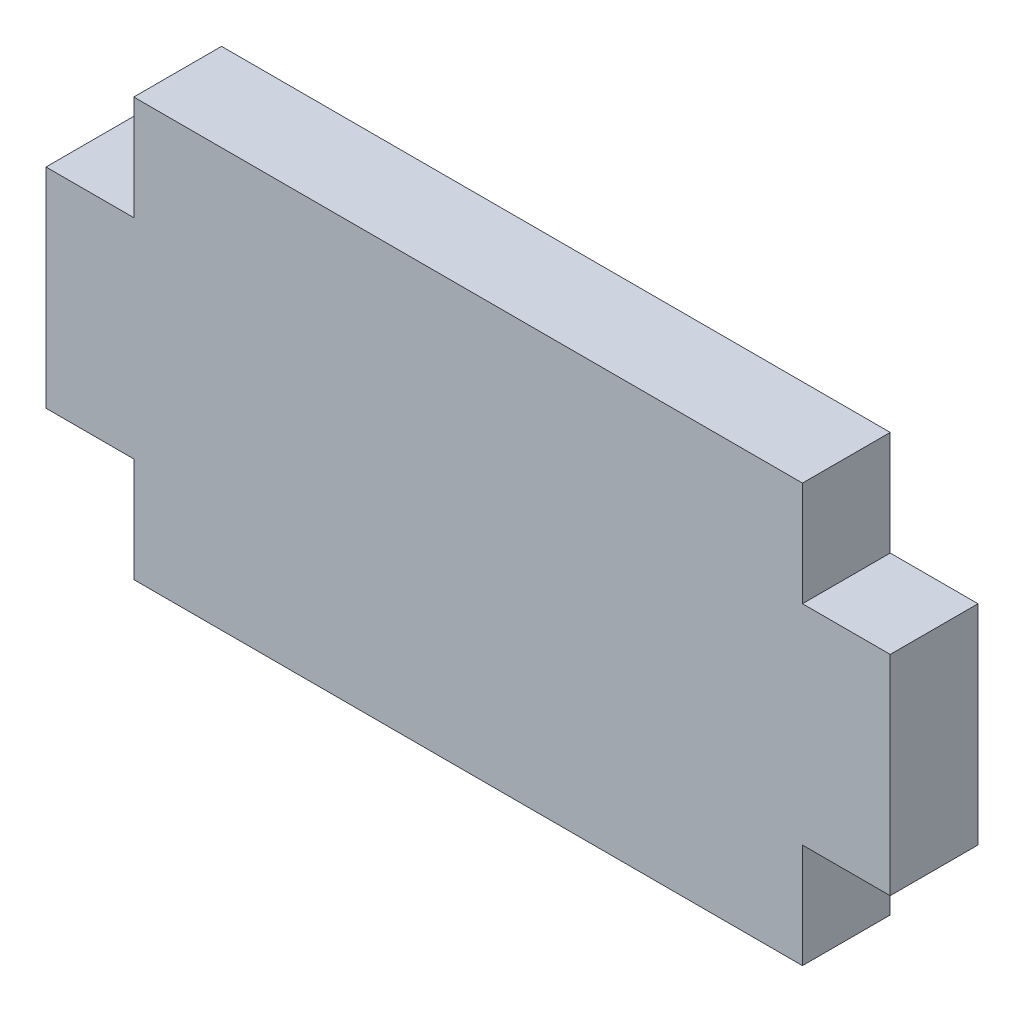
from build123d import *

# Parameters (mm, degrees)
SKETCH1_W           = 51.308
SKETCH1_H           = 25.4
BOSS_EXTRUDE1_DEPTH = 5.334
SKETCH2_W           = 5.334
SKETCH2_H           = 6.35
CUT_EXTRUDE1_DEPTH  = 114.755958488


with BuildPart() as part:
    # Sketch1 → Boss-Extrude1 (new body)
    with BuildSketch(Plane.XY):
        with Locations((-86.424766511, -6.016747393)):
            Rectangle(SKETCH1_W, SKETCH1_H)
    extrude(amount=BOSS_EXTRUDE1_DEPTH)

    # Sketch2 → Cut-Extrude1 (cut, through all)
    with BuildSketch(Plane.XY.offset(5.334)):
        with Locations((-63.437766511, -15.541747393)):
            Rectangle(SKETCH2_W, SKETCH2_H)
        with Locations((-109.411766511, 3.508252607)):
            Rectangle(SKETCH2_W, SKETCH2_H)
        with Locations((-109.411766511, -15.541747393)):
            Rectangle(SKETCH2_W, SKETCH2_H)
        with Locations((-63.437766511, 3.508252607)):
            Rectangle(SKETCH2_W, SKETCH2_H)
    extrude(amount=-CUT_EXTRUDE1_DEPTH, mode=Mode.SUBTRACT)


solid = part.part
